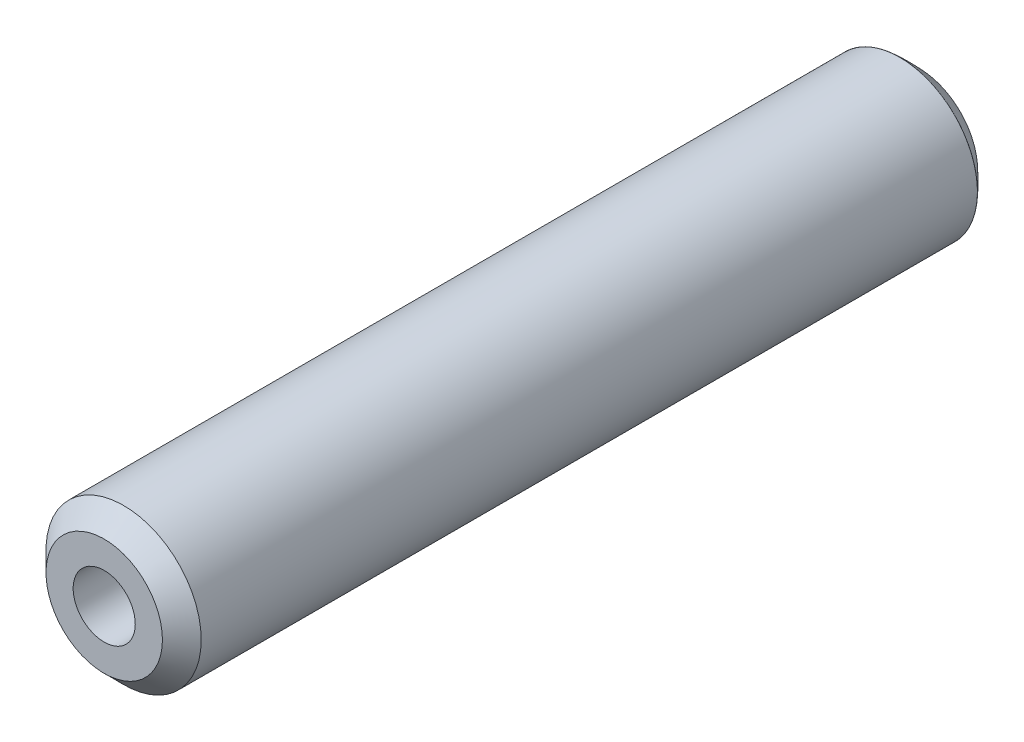
from build123d import *

# Parameters (mm, degrees)
SKETCH_2_W             = 38
SKETCH_2_H             = 39
EXTRUDE_1_DEPTH        = 2
CHAMFER_3_SIZE         = 1
SKETCH_7_R             = 4.25
CUT_EXTRUDE_3_DEPTH    = 10
SKETCH_8_W             = 2
SKETCH_8_H             = 39
CUT_EXTRUDE_4_DEPTH    = 10
FILLET_3_R             = 2
SKETCH_9_R             = 2
EXTRUDE_1_2_DEPTH      = 21
SKETCH_10_W            = 3
SKETCH_10_H            = 39
CUT_EXTRUDE_1_DEPTH    = 10
FILLET_5_R             = 2
CHAMFER_5_SIZE         = 0.5
HOLE_WIZARD_M2_5_3_D   = 2.05
HOLE_WIZARD_M2_1_D     = 1.6
HOLE_WIZARD_M2_1_DEPTH = 7
HOLE_WIZARD_M2_1_TIP   = 0.480688495
CUT_EXTRUDE_2_DEPTH    = 10
SKETCH_24_W            = 71.290640242
SKETCH_24_H            = 51.144653494
CUT_EXTRUDE_3_2_DEPTH  = 10
SKETCH_25_R            = 6.539265834
CUT_EXTRUDE_4_2_DEPTH  = 32
HOLE_WIZARD_M2_2_D     = 1.6
HOLE_WIZARD_M2_2_DEPTH = 7
HOLE_WIZARD_M2_2_TIP   = 0.480688495
FILLET_6_SIZE          = 0.5


with BuildPart() as part:
    # 草图2 → Extrude 1 (new body)
    with BuildSketch(Plane.XY):
        Rectangle(SKETCH_2_W, SKETCH_2_H)
    extrude(amount=EXTRUDE_1_DEPTH)

    # 倒角3
    chamfer_3_edges = [part.edges().sort_by_distance(p)[0] for p in [
        (-19, 19.5, 1),
        (-19, -19.5, 1),
    ]]
    chamfer(chamfer_3_edges, length=CHAMFER_3_SIZE)

    # 草图7 → Cut-Extrude 3 (cut)
    with BuildSketch(Plane.XY.offset(2)):
        with Locations((2, 0)):
            Circle(SKETCH_7_R)
    extrude(amount=-CUT_EXTRUDE_3_DEPTH, mode=Mode.SUBTRACT)

    # 草图8 → Cut-Extrude 4 (cut)
    with BuildSketch(Plane.XY.offset(2)):
        with Locations((-18, 0)):
            Rectangle(SKETCH_8_W, SKETCH_8_H)
    extrude(amount=-CUT_EXTRUDE_4_DEPTH, mode=Mode.SUBTRACT)

    # 圆角3
    fillet_3_edges = [part.edges().sort_by_distance(p)[0] for p in [
        (-17, 19.5, 1),
        (-17, -19.5, 1),
    ]]
    fillet(fillet_3_edges, radius=FILLET_3_R)

    # 草图9 → Extrude 1 2 (add)
    with BuildSketch(Plane.XY.offset(2)):
        with Locations((-15, 17.5)):
            Circle(SKETCH_9_R)
        with Locations((-15, -17.5)):
            Circle(SKETCH_9_R)
    extrude_1_2 = extrude(amount=EXTRUDE_1_2_DEPTH)

    # 镜向1: Extrude 1 2 across plane
    add(extrude_1_2.mirror(Plane.ZX))

    # 草图10 → 切除-拉伸1 (cut)
    with BuildSketch(Plane(origin=(0, 0, 0), x_dir=(-1, 0, 0), z_dir=(0, 0, -1))):
        with Locations((-17.5, 0)):
            Rectangle(SKETCH_10_W, SKETCH_10_H)
    extrude(amount=-CUT_EXTRUDE_1_DEPTH, mode=Mode.SUBTRACT)

    # 圆角5
    fillet_5_edges = [part.edges().sort_by_distance(p)[0] for p in [
        (16, -19.5, 1),
        (16, 19.5, 1),
    ]]
    fillet(fillet_5_edges, radius=FILLET_5_R)

    # 倒角5
    chamfer_5_edges = [part.edges().sort_by_distance(p)[0] for p in [
        (-17, -17.5, 23),
        (-17, 17.5, 23),
        (15.414213562, 18.914213562, 0),
        (16, 0, 0),
        (-0.5, 19.5, 0),
        (15.414213562, -18.914213562, 0),
        (-16.414213562, 18.914213562, 0),
        (-0.5, -19.5, 0),
        (-17, 0, 0),
        (-16.414213562, -18.914213562, 0),
    ]]
    chamfer(chamfer_5_edges, length=CHAMFER_5_SIZE)

    # M2.5 螺纹孔3 (through all)
    with Locations(Plane(origin=(9.5, 15.5, 0), x_dir=(-1, 0, 0), z_dir=(0, 0, -1))):
        with Locations((0, 0), (15, 0), (0, -31), (15, -31)):
            Hole(HOLE_WIZARD_M2_5_3_D / 2)

    # M2 螺纹孔1
    with Locations(Plane(origin=(-15, 17.5, 23), x_dir=(1, 0, 0), z_dir=(0, 0, 1))):
        with Locations((0, 0), (0, -35)):
            Hole(HOLE_WIZARD_M2_1_D / 2, depth=HOLE_WIZARD_M2_1_DEPTH)
            with Locations((0, 0, -(HOLE_WIZARD_M2_1_DEPTH + HOLE_WIZARD_M2_1_TIP / 2))):  # 118° drill point
                Cone(0, HOLE_WIZARD_M2_1_D / 2, HOLE_WIZARD_M2_1_TIP, mode=Mode.SUBTRACT)

    # 草图23 → 切除-拉伸2 (cut)
    with BuildSketch(Plane(origin=(0, 0, 0), x_dir=(-1, 0, 0), z_dir=(0, 0, -1))):
        with BuildLine():
            Line((-0.95, 16.2), (-0.95, 9.8))
            ThreePointArc((-0.95, 9.8), (-2, 8.75), (-3.05, 9.8))
            Line((-3.05, 9.8), (-3.05, 16.2))
            ThreePointArc((-3.05, 16.2), (-2, 17.25), (-0.95, 16.2))
        make_face()
    cut_extrude_2 = extrude(amount=-CUT_EXTRUDE_2_DEPTH, mode=Mode.SUBTRACT)

    # 镜向2: 切除-拉伸2 across plane
    add(cut_extrude_2.mirror(Plane.ZX), mode=Mode.SUBTRACT)

    # 草图24 → Cut-Extrude 3 2 (cut)
    with BuildSketch(Plane.XY.offset(2)):
        Rectangle(SKETCH_24_W, SKETCH_24_H)
    extrude(amount=-CUT_EXTRUDE_3_2_DEPTH, mode=Mode.SUBTRACT)


with BuildPart() as cut_extrude_3_2_piece_1:
    # of the separate pieces the step leaves, piece 1, a body of its own (cut_extrude_3_2_pieces)
    add(part.part.solids().sort_by_distance((-13, 17.5, 22.5))[0])

    # 草图25 → Cut-Extrude 4 2 (cut)
    with BuildSketch(Plane(origin=(0, 0, 2), x_dir=(-1, 0, 0), z_dir=(0, 0, -1))):
        with Locations((15, 17.5)):
            Circle(SKETCH_25_R)
    extrude(amount=-CUT_EXTRUDE_4_2_DEPTH, mode=Mode.SUBTRACT)


with BuildPart() as cut_extrude_3_2_piece_2:
    # of the separate pieces the step leaves, piece 2, a body of its own (cut_extrude_3_2_pieces)
    add(part.part.solids().sort_by_distance((-13, -17.5, 2))[0])

    # M2 螺纹孔2
    with Locations(Plane(origin=(-15, -17.5, 2), x_dir=(-1, 0, 0), z_dir=(0, 0, -1))):
        with Locations((0, 0)):
            Hole(HOLE_WIZARD_M2_2_D / 2, depth=HOLE_WIZARD_M2_2_DEPTH)
            with Locations((0, 0, -(HOLE_WIZARD_M2_2_DEPTH + HOLE_WIZARD_M2_2_TIP / 2))):  # 118° drill point
                Cone(0, HOLE_WIZARD_M2_2_D / 2, HOLE_WIZARD_M2_2_TIP, mode=Mode.SUBTRACT)

    # 圆角6
    # a fillet whose section is not a circle: 0.5 mm, written as the material it takes off along each edge
    with BuildSketch(Plane(origin=(-15, -17.5, 2), x_dir=(1, 0, 0), z_dir=(0, -1, 0))) as fillet_6_piece_1:
        with BuildLine():
            Bezier((2, FILLET_6_SIZE), (2, 0), (2 - FILLET_6_SIZE, 0), weights=[1, 0.035355339, 1])
            Line((2 - FILLET_6_SIZE, 0), (2, 0))
            Line((2, 0), (2, FILLET_6_SIZE))
        make_face()
    revolve(axis=Axis((-15, -17.5, 2), (0, 0, 1)), mode=Mode.SUBTRACT)


solid = cut_extrude_3_2_piece_2.part
